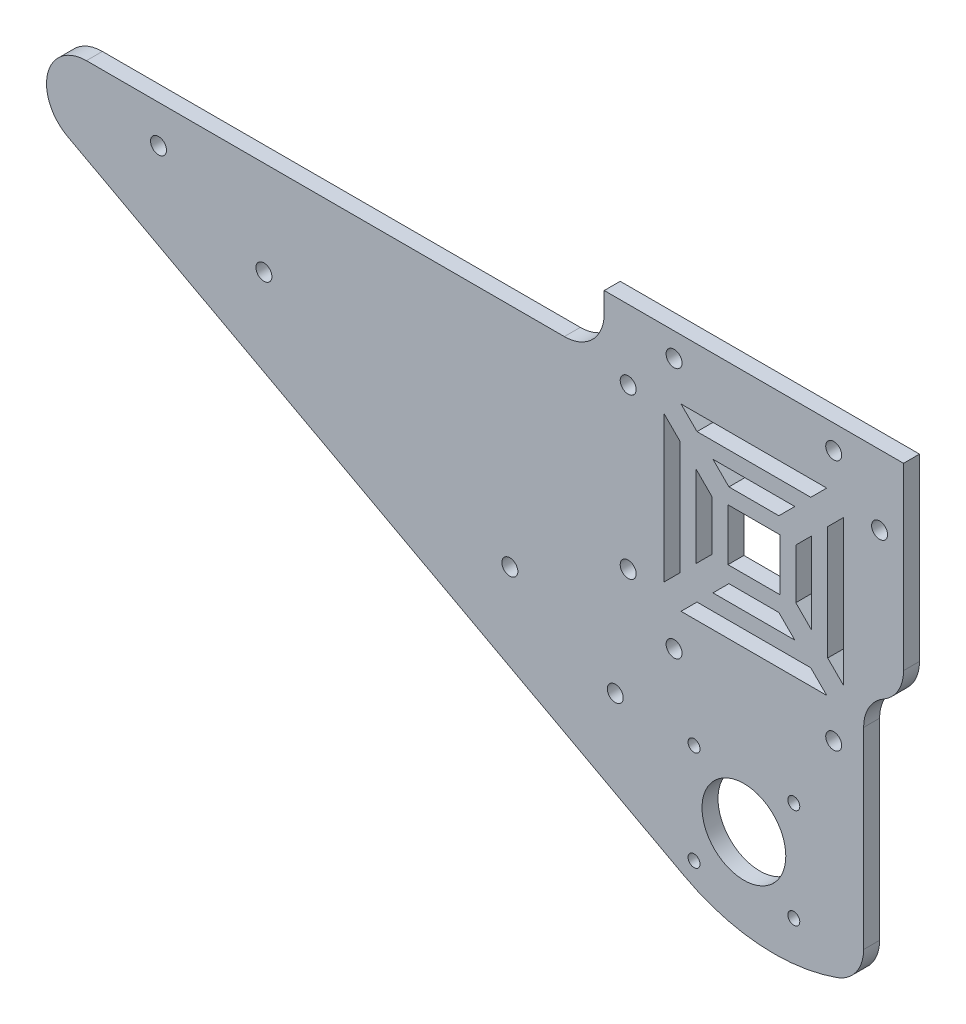
from build123d import *

# Parameters (mm, degrees)
EXTRUDE_1_DEPTH     = 4
SKETCH_3_R          = 2
CUT_EXTRUDE_1_DEPTH = 272.02260581
SKETCH_4_R          = 10.5
SKETCH_4_R_2        = 1.5
CUT_EXTRUDE_2_DEPTH = 272.02260581
SKETCH_5_R          = 2
CUT_EXTRUDE_3_DEPTH = 272.02260581
SKETCH_6_W          = 10
SKETCH_6_H          = 62
CUT_EXTRUDE_4_DEPTH = 272.02260581
FILLET_1_R          = 10
SKETCH_7_W          = 13
SKETCH_7_H          = 13
CUT_EXTRUDE_5_DEPTH = 4
EXTRUDE_2_DEPTH     = 4
FILLET_2_R          = 10


with BuildPart() as part:
    # 草图2 → 凸台-拉伸1 (new body)
    with BuildSketch(Plane.XY):
        Polygon((0, 0), (-75, 0), (-75, -15), (-244.434557418, -15), (-55, -117), (0, -117), align=None)
    extrude(amount=EXTRUDE_1_DEPTH)

    # 草图3 → 切除-拉伸1 (cut, through all)
    with BuildSketch(Plane.XY.offset(4)):
        with Locations((-57.5, -6)):
            Circle(SKETCH_3_R)
        with Locations((-69, -17.5)):
            Circle(SKETCH_3_R)
        with Locations((-17.5, -6)):
            Circle(SKETCH_3_R)
        with Locations((-6, -17.5)):
            Circle(SKETCH_3_R)
        with Locations((-6, -57.5)):
            Circle(SKETCH_3_R)
        with Locations((-17.5, -69)):
            Circle(SKETCH_3_R)
        with Locations((-57.5, -69)):
            Circle(SKETCH_3_R)
        with Locations((-69, -57.5)):
            Circle(SKETCH_3_R)
    extrude(amount=-CUT_EXTRUDE_1_DEPTH, mode=Mode.SUBTRACT)

    # 草图4 → 切除-拉伸2 (cut, through all)
    with BuildSketch(Plane.XY.offset(4)):
        with Locations((-40, -100)):
            Circle(SKETCH_4_R)
        with Locations((-52.5, -112.5)):
            Circle(SKETCH_4_R_2)
        with Locations((-27.5, -112.5)):
            Circle(SKETCH_4_R_2)
        with Locations((-27.5, -87.5)):
            Circle(SKETCH_4_R_2)
        with Locations((-52.5, -87.5)):
            Circle(SKETCH_4_R_2)
    extrude(amount=-CUT_EXTRUDE_2_DEPTH, mode=Mode.SUBTRACT)

    # 草图5 → 切除-拉伸3 (cut, through all)
    with BuildSketch(Plane.XY.offset(4)):
        with Locations((-98.653292605, -71.825698472)):
            Circle(SKETCH_5_R)
        with Locations((-72.238972, -86.048344744)):
            Circle(SKETCH_5_R)
        with Locations((-160.286707351, -38.639523839)):
            Circle(SKETCH_5_R)
        with Locations((-186.701027956, -24.416877568)):
            Circle(SKETCH_5_R)
    extrude(amount=-CUT_EXTRUDE_3_DEPTH, mode=Mode.SUBTRACT)

    # 草图6 → 切除-拉伸4 (cut, through all)
    with BuildSketch(Plane.XY.offset(4)):
        with Locations((-5, -86)):
            Rectangle(SKETCH_6_W, SKETCH_6_H)
    extrude(amount=-CUT_EXTRUDE_4_DEPTH, mode=Mode.SUBTRACT)

    # 圆角1
    fillet_1_edges = [part.edges().sort_by_distance(p)[0] for p in [
        (0, -55, 2),
    ]]
    fillet(fillet_1_edges, radius=FILLET_1_R - 0.0001)  # a hair under: the kernel refuses the full size

    # 草图7 → 切除-拉伸5 (cut)
    with BuildSketch(Plane.XY.offset(4)):
        Polygon((-19.242640687, -15), (-55.757359313, -15), (-51.757359313, -19), (-23.242640687, -19), align=None)
        Polygon((-56, -23.242640687), (-60, -19.242640687), (-60, -55.757359313), (-56, -51.757359313), align=None)
        Polygon((-51.757359313, -56), (-55.757359313, -60), (-19.242640687, -60), (-23.242640687, -56), align=None)
        Polygon((-15, -55.757359313), (-15, -19.242640687), (-19, -23.242640687), (-19, -51.757359313), align=None)
        Polygon((-27.242640687, -23), (-47.757359313, -23), (-43.757359313, -27), (-31.242640687, -27), align=None)
        Polygon((-48, -31.242640687), (-52, -27.242640687), (-52, -47.757359313), (-48, -43.757359313), align=None)
        Polygon((-43.757359313, -48), (-47.757359313, -52), (-27.242640687, -52), (-31.242640687, -48), align=None)
        Polygon((-23, -47.757359313), (-23, -27.242640687), (-27, -31.242640687), (-27, -43.757359313), align=None)
        with Locations((-37.5, -37.5)):
            Rectangle(SKETCH_7_W, SKETCH_7_H)
    extrude(amount=-CUT_EXTRUDE_5_DEPTH, mode=Mode.SUBTRACT)

    # 草图8 → 凸台-拉伸2 (add)
    with BuildSketch(Plane.XY.offset(4)):
        with BuildLine():
            Line((-10, -117), (-55, -117))
            ThreePointArc((-55, -117), (-32.5, -122.672487724), (-10, -117))
        make_face()
    extrude(amount=-EXTRUDE_2_DEPTH)

    # 圆角2
    fillet_2_edges = [part.edges().sort_by_distance(p)[0] for p in [
        (-10, -117, 2),
        (-10, -55, 2),
        (-244.434557418, -15, 2),
        (-75, -15, 2),
    ]]
    fillet(fillet_2_edges, radius=FILLET_2_R)


solid = part.part
